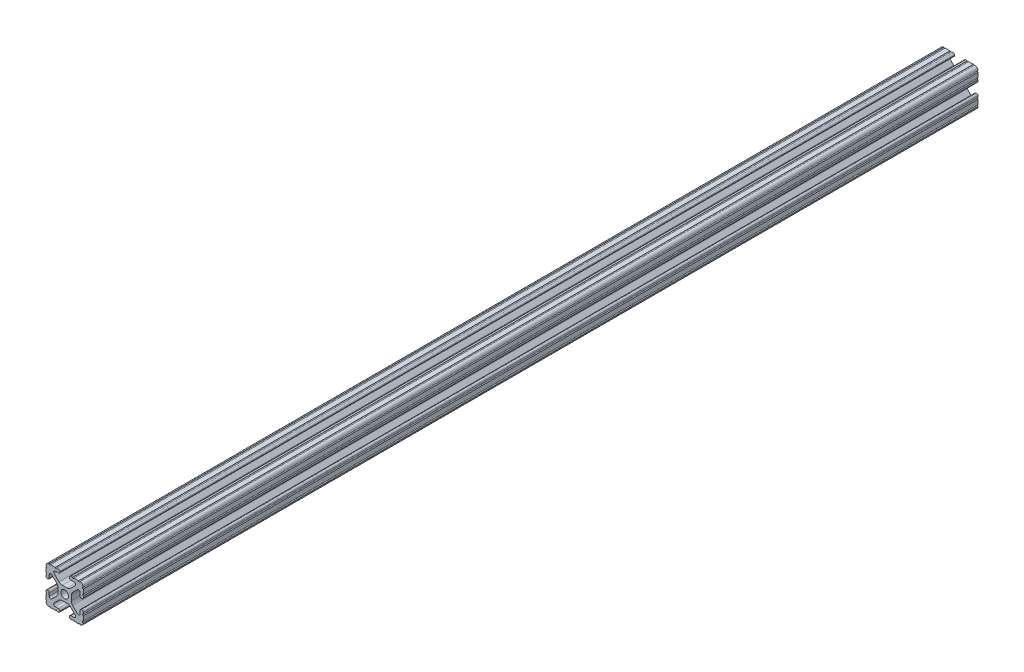
from build123d import *

# Parameters (mm, degrees)
SKETCH1_R           = 2.6035
BOSS_EXTRUDE1_DEPTH = 304.8


with BuildPart() as part:
    # Sketch1 → Boss-Extrude1 (new, symmetric)
    with BuildSketch(Plane.XY):
        with BuildLine():
            Line((-7.179650497, -8.645192506), (-3.952270251, -5.423690499))
            ThreePointArc((-3.952270251, -5.423690499), (-2.922936451, -4.736929036), (-1.709253557, -4.4958))
            Line((-1.709253557, -4.4958), (1.709253557, -4.4958))
            ThreePointArc((1.709253557, -4.4958), (2.922936451, -4.736929036), (3.952270251, -5.423690499))
            Line((3.952270251, -5.423690499), (7.179650497, -8.645192506))
            ThreePointArc((7.179650497, -8.645192506), (7.41473083, -9.822813117), (6.416408329, -10.4902))
            Line((6.416408329, -10.4902), (4.287512407, -10.4902))
            ThreePointArc((4.287512407, -10.4902), (3.54574862, -10.79744862), (3.2385, -11.539212407))
            Line((3.2385, -11.539212407), (3.2385, -11.650987593))
            ThreePointArc((3.2385, -11.650987593), (3.54574862, -12.39275138), (4.287512407, -12.7))
            Line((4.287512407, -12.7), (5.317126718, -12.7))
            ThreePointArc((5.317126718, -12.7), (5.825126718, -12.192), (6.333126718, -12.7))
            Line((6.333126718, -12.7), (9.550443118, -12.7))
            ThreePointArc((9.550443118, -12.7), (10.058366869, -12.192000006), (10.566443095, -12.699847501))
            ThreePointArc((10.566443095, -12.699847501), (12.082537762, -12.08250727), (12.699846982, -10.566399977))
            ThreePointArc((12.699846982, -10.566399977), (12.192000006, -10.058323491), (12.7, -9.5504))
            Line((12.7, -9.5504), (12.7, -6.3330836))
            ThreePointArc((12.7, -6.3330836), (12.192, -5.8250836), (12.7, -5.3170836))
            Line((12.7, -5.3170836), (12.7, -4.287469289))
            ThreePointArc((12.7, -4.287469289), (12.39275138, -3.545705502), (11.650987593, -3.238456882))
            Line((11.650987593, -3.238456882), (11.539212407, -3.238456882))
            ThreePointArc((11.539212407, -3.238456882), (10.79744862, -3.545705502), (10.4902, -4.287469289))
            Line((10.4902, -4.287469289), (10.4902, -6.402089023))
            ThreePointArc((10.4902, -6.402089023), (9.856505071, -7.351067942), (8.737131347, -7.129408934))
            Line((8.737131347, -7.129408934), (5.441005833, -3.840816462))
            ThreePointArc((5.441005833, -3.840816462), (4.750877967, -2.809883091), (4.5085, -1.593185507))
            Line((4.5085, -1.593185507), (4.5085, 1.593185507))
            ThreePointArc((4.5085, 1.593185507), (4.750877967, 2.809883091), (5.441005833, 3.840816462))
            Line((5.441005833, 3.840816462), (8.737131347, 7.129408934))
            ThreePointArc((8.737131347, 7.129408934), (9.856505071, 7.351067942), (10.4902, 6.402089023))
            Line((10.4902, 6.402089023), (10.4902, 4.287469289))
            ThreePointArc((10.4902, 4.287469289), (10.79744862, 3.545705502), (11.539212407, 3.238456882))
            Line((11.539212407, 3.238456882), (11.650987593, 3.238456882))
            ThreePointArc((11.650987593, 3.238456882), (12.39275138, 3.545705502), (12.7, 4.287469289))
            Line((12.7, 4.287469289), (12.7, 5.3170836))
            ThreePointArc((12.7, 5.3170836), (12.192, 5.8250836), (12.7, 6.3330836))
            Line((12.7, 6.3330836), (12.7, 9.5504))
            ThreePointArc((12.7, 9.5504), (12.192000006, 10.058323491), (12.699846982, 10.566399977))
            ThreePointArc((12.699846982, 10.566399977), (12.082537762, 12.08250727), (10.566443095, 12.699847501))
            ThreePointArc((10.566443095, 12.699847501), (10.058366869, 12.192000006), (9.550443118, 12.7))
            Line((9.550443118, 12.7), (6.333126718, 12.7))
            ThreePointArc((6.333126718, 12.7), (5.825126718, 12.192), (5.317126718, 12.7))
            Line((5.317126718, 12.7), (4.287512407, 12.7))
            ThreePointArc((4.287512407, 12.7), (3.54574862, 12.39275138), (3.2385, 11.650987593))
            Line((3.2385, 11.650987593), (3.2385, 11.539212407))
            ThreePointArc((3.2385, 11.539212407), (3.54574862, 10.79744862), (4.287512407, 10.4902))
            Line((4.287512407, 10.4902), (6.476788598, 10.4902))
            ThreePointArc((6.476788598, 10.4902), (7.432222385, 9.85140422), (7.207036008, 8.724370562))
            Line((7.207036008, 8.724370562), (3.898272566, 5.423169045))
            ThreePointArc((3.898272566, 5.423169045), (2.869120213, 4.736787962), (1.655778399, 4.4958))
            Line((1.655778399, 4.4958), (-1.655778399, 4.4958))
            ThreePointArc((-1.655778399, 4.4958), (-2.869120213, 4.736787962), (-3.898272566, 5.423169045))
            Line((-3.898272566, 5.423169045), (-7.207036008, 8.724370562))
            ThreePointArc((-7.207036008, 8.724370562), (-7.432222385, 9.85140422), (-6.476788598, 10.4902))
            Line((-6.476788598, 10.4902), (-4.287512407, 10.4902))
            ThreePointArc((-4.287512407, 10.4902), (-3.54574862, 10.79744862), (-3.2385, 11.539212407))
            Line((-3.2385, 11.539212407), (-3.2385, 11.650987593))
            ThreePointArc((-3.2385, 11.650987593), (-3.54574862, 12.39275138), (-4.287512407, 12.7))
            Line((-4.287512407, 12.7), (-5.317126718, 12.7))
            ThreePointArc((-5.317126718, 12.7), (-5.825126718, 12.192), (-6.333126718, 12.7))
            Line((-6.333126718, 12.7), (-9.550443118, 12.7))
            ThreePointArc((-9.550443118, 12.7), (-10.058366869, 12.192000006), (-10.566443095, 12.699847501))
            ThreePointArc((-10.566443095, 12.699847501), (-12.082537762, 12.08250727), (-12.699846982, 10.566399977))
            ThreePointArc((-12.699846982, 10.566399977), (-12.192000006, 10.058323491), (-12.7, 9.5504))
            Line((-12.7, 9.5504), (-12.7, 6.3330836))
            ThreePointArc((-12.7, 6.3330836), (-12.192, 5.8250836), (-12.7, 5.3170836))
            Line((-12.7, 5.3170836), (-12.7, 4.287469289))
            ThreePointArc((-12.7, 4.287469289), (-12.39275138, 3.545705502), (-11.650987593, 3.238456882))
            Line((-11.650987593, 3.238456882), (-11.539212407, 3.238456882))
            ThreePointArc((-11.539212407, 3.238456882), (-10.79744862, 3.545705502), (-10.4902, 4.287469289))
            Line((-10.4902, 4.287469289), (-10.4902, 6.402089023))
            ThreePointArc((-10.4902, 6.402089023), (-9.856505071, 7.351067942), (-8.737131347, 7.129408934))
            Line((-8.737131347, 7.129408934), (-5.441005833, 3.840816462))
            ThreePointArc((-5.441005833, 3.840816462), (-4.750877967, 2.809883091), (-4.5085, 1.593185507))
            Line((-4.5085, 1.593185507), (-4.5085, -1.593185507))
            ThreePointArc((-4.5085, -1.593185507), (-4.750877967, -2.809883091), (-5.441005833, -3.840816462))
            Line((-5.441005833, -3.840816462), (-8.737131347, -7.129408934))
            ThreePointArc((-8.737131347, -7.129408934), (-9.856505071, -7.351067942), (-10.4902, -6.402089023))
            Line((-10.4902, -6.402089023), (-10.4902, -4.287469289))
            ThreePointArc((-10.4902, -4.287469289), (-10.79744862, -3.545705502), (-11.539212407, -3.238456882))
            Line((-11.539212407, -3.238456882), (-11.650987593, -3.238456882))
            ThreePointArc((-11.650987593, -3.238456882), (-12.39275138, -3.545705502), (-12.7, -4.287469289))
            Line((-12.7, -4.287469289), (-12.7, -5.3170836))
            ThreePointArc((-12.7, -5.3170836), (-12.192, -5.8250836), (-12.7, -6.3330836))
            Line((-12.7, -6.3330836), (-12.7, -9.5504))
            ThreePointArc((-12.7, -9.5504), (-12.192000006, -10.058323491), (-12.699846982, -10.566399977))
            ThreePointArc((-12.699846982, -10.566399977), (-12.082537762, -12.08250727), (-10.566443095, -12.699847501))
            ThreePointArc((-10.566443095, -12.699847501), (-10.058366869, -12.192000006), (-9.550443118, -12.7))
            Line((-9.550443118, -12.7), (-6.333126718, -12.7))
            ThreePointArc((-6.333126718, -12.7), (-5.825126718, -12.192), (-5.317126718, -12.7))
            Line((-5.317126718, -12.7), (-4.287512407, -12.7))
            ThreePointArc((-4.287512407, -12.7), (-3.54574862, -12.39275138), (-3.2385, -11.650987593))
            Line((-3.2385, -11.650987593), (-3.2385, -11.539212407))
            ThreePointArc((-3.2385, -11.539212407), (-3.54574862, -10.79744862), (-4.287512407, -10.4902))
            Line((-4.287512407, -10.4902), (-6.416408329, -10.4902))
            ThreePointArc((-6.416408329, -10.4902), (-7.41473083, -9.822813117), (-7.179650497, -8.645192506))
        make_face()
        Circle(SKETCH1_R, mode=Mode.SUBTRACT)
    extrude(amount=BOSS_EXTRUDE1_DEPTH, both=True)


solid = part.part
